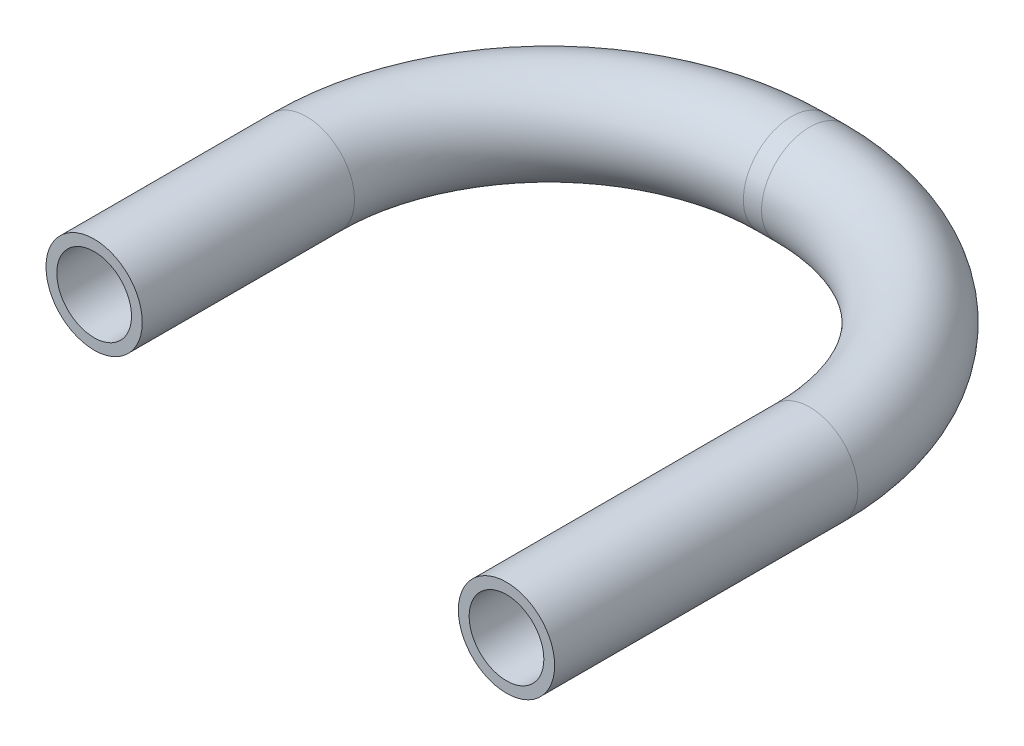
from build123d import *

# Parameters (mm, degrees)
SKETCH2_R   = 3.175
SKETCH2_R_2 = 2.4638


with BuildPart() as part:
    # Sweep-Thin1: sweep along a path in Sketch1
    with BuildLine(Plane(origin=(0, 0, 0), x_dir=(1, 0, 0), z_dir=(0, 1, 0))) as sweep_thin1_path:
        Line((0, 0), (0, 14))
        ThreePointArc((0, 14), (4.686291501, 25.313708499), (16, 30))
        Line((16, 30), (17.2, 30))
        ThreePointArc((17.2, 30), (28.513708499, 25.313708499), (33.2, 14))
        Line((33.2, 14), (33.2, -6))
    # Sketch2 → Sweep-Thin1 (sweep)
    with BuildSketch(Plane.XY):
        Circle(SKETCH2_R)
        Circle(SKETCH2_R_2, mode=Mode.SUBTRACT)
    sweep(path=sweep_thin1_path.line)


solid = part.part
